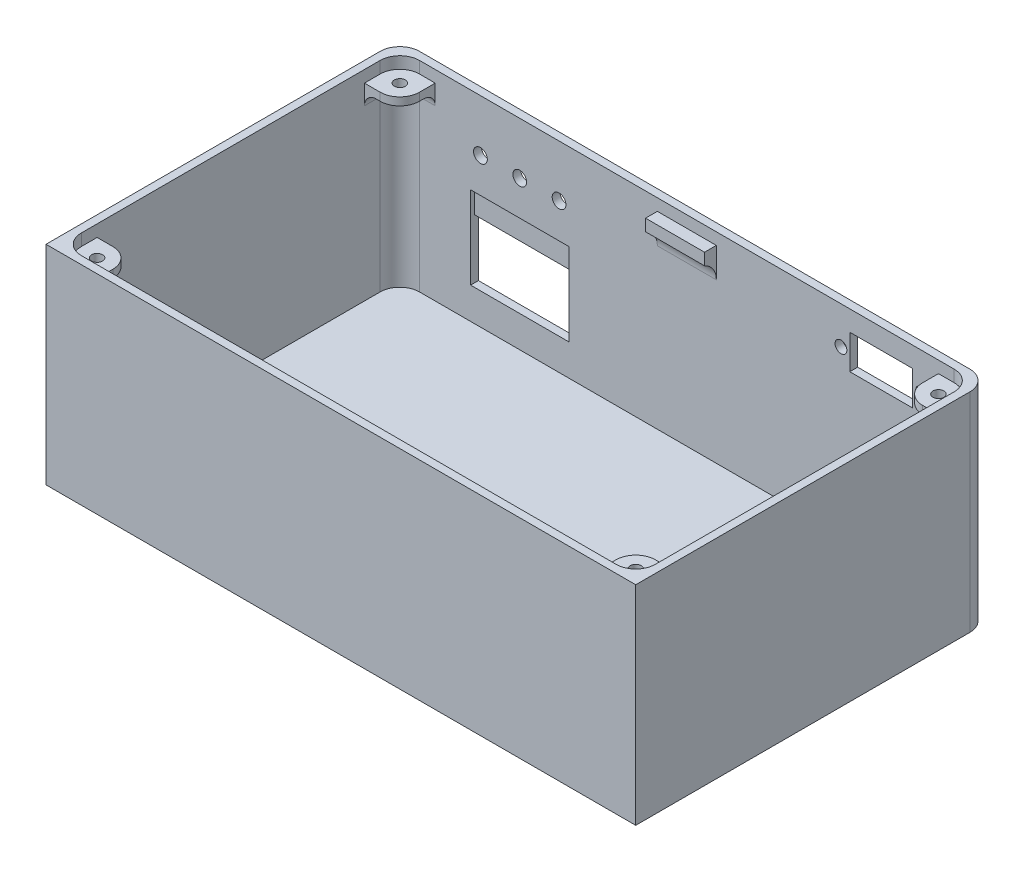
from build123d import *

# Parameters (mm, degrees)
SKETCH1_W           = 150
SKETCH1_H           = 90
BOSS_EXTRUDE1_DEPTH = 50
SHELL1_T            = -2
SKETCH2_W           = 9
SKETCH2_H           = 9
BOSS_EXTRUDE2_DEPTH = 2
SKETCH10_R          = 1.4
CUT_EXTRUDE5_DEPTH  = 14
SKETCH13_R          = 1.9
BOSS_EXTRUDE4_DEPTH = 150
SKETCH14_W          = 152.119468056
SKETCH14_H          = 14
CUT_EXTRUDE7_DEPTH  = 176
SKETCH15_W          = 150
SKETCH15_H          = 90
BOSS_EXTRUDE5_DEPTH = 3
SKETCH16_W          = 15
SKETCH16_H          = 3
BOSS_EXTRUDE6_DEPTH = 3
FILLET1_R           = 5
SKETCH17_R          = 7
CUT_EXTRUDE8_DEPTH  = 10
SKETCH19_R          = 1.5
SKETCH19_R_2        = 1.75
SKETCH19_W          = 25
SKETCH19_H          = 15
SKETCH19_W_2        = 16
SKETCH19_H_2        = 8.7
CUT_EXTRUDE9_DEPTH  = 10
SKETCH21_W          = 1.346153846
SKETCH21_H          = 0.358974358
CUT_EXTRUDE10_DEPTH = 0.5
SKETCH23_W          = 25
SKETCH23_H          = 21
CUT_EXTRUDE12_DEPTH = 1
FILLET2_R           = 5
FILLET3_R           = 3


with BuildPart() as part:
    # Sketch1 → Boss-Extrude1 (new body)
    with BuildSketch(Plane(origin=(0, 0, 0), x_dir=(1, 0, 0), z_dir=(0, 1, 0))):
        with Locations((-0.132743363, -2.986725664)):
            Rectangle(SKETCH1_W, SKETCH1_H)
    extrude(amount=BOSS_EXTRUDE1_DEPTH)

    # Shell1
    shell1_openings = [part.faces().sort_by_distance(p)[0] for p in [
        (-0.132743363, 50, 2.986725664),
    ]]
    offset(amount=SHELL1_T, openings=shell1_openings, kind=Kind.INTERSECTION)

    # Sketch2 → Boss-Extrude2 (add)
    with BuildSketch(Plane(origin=(0, 50, 0), x_dir=(1, 0, 0), z_dir=(0, 1, 0))):
        with Locations((-68.632743363, -41.486725664)):
            Rectangle(SKETCH2_W, SKETCH2_H)
        with Locations((-68.632743363, 35.513274336)):
            Rectangle(SKETCH2_W, SKETCH2_H)
        with Locations((68.367256637, -41.486725664)):
            Rectangle(SKETCH2_W, SKETCH2_H)
        with Locations((68.367256637, 35.513274336)):
            Rectangle(SKETCH2_W, SKETCH2_H)
    extrude(amount=-BOSS_EXTRUDE2_DEPTH)

    # Sketch10 → Cut-Extrude5 (cut)
    with BuildSketch(Plane(origin=(0, 50, 0), x_dir=(1, 0, 0), z_dir=(0, 1, 0))):
        with Locations(Location((-68.632743363, 35.513274336, 0), (0, 0, 270))):
            Circle(SKETCH10_R)
        with Locations(Location((-68.632743363, -41.486725664, 0), (0, 0, 270))):
            Circle(SKETCH10_R)
        with Locations(Location((68.367256637, -41.486725664, 0), (0, 0, 270))):
            Circle(SKETCH10_R)
        with Locations(Location((68.367256637, 35.513274336, 0), (0, 0, 270))):
            Circle(SKETCH10_R)
    extrude(amount=-CUT_EXTRUDE5_DEPTH, mode=Mode.SUBTRACT)

    # Sketch13 → Boss-Extrude4 (add)
    with BuildSketch(Plane.ZY.offset(75.132743363)):
        with BuildLine():
            Line((47.986725664, 0), (45.986725664, -5))
            ThreePointArc((45.986725664, -5), (40.986725664, -10), (35.986725664, -5))
            Line((35.986725664, -5), (35.986725664, 0))
            Line((35.986725664, 0), (47.986725664, 0))
        make_face()
        with Locations((40.986725664, -5)):
            Circle(SKETCH13_R, mode=Mode.SUBTRACT)
    extrude(amount=-BOSS_EXTRUDE4_DEPTH)

    # Sketch14 → Cut-Extrude7 (cut)
    with BuildSketch(Plane.XZ):
        with Locations((-0.142633699, 40.986725664)):
            Rectangle(SKETCH14_W, SKETCH14_H)
    extrude(amount=CUT_EXTRUDE7_DEPTH, mode=Mode.SUBTRACT)

    # Sketch15 → Boss-Extrude5 (add)
    with BuildSketch(Plane(origin=(0, 50, 0), x_dir=(1, 0, 0), z_dir=(0, 1, 0))):
        with Locations((-0.132743363, -2.986725664)):
            Rectangle(SKETCH15_W, SKETCH15_H)
        Polygon((-73.132743363, 40.013274336), (72.044159397, 40.013274336), (72.867256637, 40.013274336), (72.867256637, 31.013274336), (72.867256637, -36.986725664), (72.867256637, -45.986725664), (72.044159397, -45.986725664), (-73.132743363, -45.986725664), align=None, mode=Mode.SUBTRACT)
    extrude(amount=BOSS_EXTRUDE5_DEPTH)

    # Sketch16 → Boss-Extrude6 (add)
    with BuildSketch(Plane.XY.offset(-40.013274336)):
        with Locations((-0.132743363, 48.5)):
            Rectangle(SKETCH16_W, SKETCH16_H)
    boss_extrude6 = extrude(amount=BOSS_EXTRUDE6_DEPTH)

    # Mirror1: Boss-Extrude6 across plane
    add(boss_extrude6.mirror(Plane.XY.offset(2.986725664)))

    # Fillet1
    fillet1_edges = [part.edges().sort_by_distance(p)[0] for p in [
        (63.867256637, 49, -31.013274336),
        (63.867256637, 49, 36.986725664),
        (-64.132743363, 49, 36.986725664),
        (-64.132743363, 49, -31.013274336),
    ]]
    fillet(fillet1_edges, radius=FILLET1_R)

    # Sketch17 → Cut-Extrude8 (cut)
    with BuildSketch(Plane(origin=(0, 2, 0), x_dir=(1, 0, 0), z_dir=(0, 1, 0))):
        with Locations(Location((-25.132743363, -2.986725664, 0), (0, 0, 270))):
            Circle(SKETCH17_R)
        with Locations(Location((24.867256637, -2.986725664, 0), (0, 0, 270))):
            Circle(SKETCH17_R)
    extrude(amount=-CUT_EXTRUDE8_DEPTH, mode=Mode.SUBTRACT)

    # Sketch19 → Cut-Extrude9 (cut)
    with BuildSketch(Plane(origin=(0, 0, -42.013274336), x_dir=(-1, 0, 0), z_dir=(0, 0, -1))):
        with Locations((-39.067256637, 43.5)):
            Circle(SKETCH19_R)
        with Locations((-59.567256637, 43.5)):
            Circle(SKETCH19_R)
        with Locations((52.632743363, 39.810326453)):
            Circle(SKETCH19_R_2)
        with Locations((42.632743363, 39.810326453)):
            Circle(SKETCH19_R_2)
        with Locations((32.632743363, 39.810326453)):
            Circle(SKETCH19_R_2)
        with Locations((42.632743363, 17.5)):
            Rectangle(SKETCH19_W, SKETCH19_H)
        with Locations((-49.317256637, 43.5)):
            Rectangle(SKETCH19_W_2, SKETCH19_H_2)
    extrude(amount=-CUT_EXTRUDE9_DEPTH, mode=Mode.SUBTRACT)

    # Sketch21 → Cut-Extrude10 (cut)
    with BuildSketch(Plane(origin=(0, 0, -42.013274336), x_dir=(-1, 0, 0), z_dir=(0, 0, -1))):
        Polygon((52.94662403, 44.571959528), (52.94662403, 43.539908245), (52.632521466, 43.539908245), (52.632521466, 44.571959528), (51.600470184, 44.571959528), (51.600470184, 44.886062092), (52.632521466, 44.886062092), (52.632521466, 45.918113374), (52.94662403, 45.918113374), (52.94662403, 44.886062092), (53.978675312, 44.886062092), (53.978675312, 44.571959528), align=None)
        with Locations((42.44662403, 45.110421066)):
            Rectangle(SKETCH21_W, SKETCH21_H)
        Polygon((34.638931723, 46.456574912), (34.17689246, 42.956574912), (34.132020665, 42.956574912), (32.687008646, 45.828369784), (31.246203357, 42.956574912), (31.201331562, 42.956574912), (30.735085569, 46.456574912), (31.049188133, 46.456574912), (31.385726594, 43.94024879), (32.648446947, 46.456574912), (32.71996137, 46.456574912), (33.988290697, 43.932536451), (34.322725793, 46.456574912), align=None)
    extrude(amount=-CUT_EXTRUDE10_DEPTH, mode=Mode.SUBTRACT)

    # Sketch23 → Cut-Extrude12 (cut)
    with BuildSketch(Plane.XY.offset(-40.013274336)):
        with Locations((-42.632743363, 20.5)):
            Rectangle(SKETCH23_W, SKETCH23_H)
    extrude(amount=-CUT_EXTRUDE12_DEPTH, mode=Mode.SUBTRACT)

    # Fillet2
    # the kernel refuses this fillet: 5 mm, written as the material it adds along each edge
    with BuildSketch(Plane(origin=(-73.132743363, 37.5, 45.986725664), x_dir=(1, 0, 0), z_dir=(0, 1, 0)), Plane(origin=(72.867256637, 37.5, -40.013274336), x_dir=(-1, 0, 0), z_dir=(0, 1, 0))) as fillet2_piece_1:
        with BuildLine():
            CenterArc((FILLET2_R, FILLET2_R), FILLET2_R, 180, 90)
            Line((0, FILLET2_R), (0, 0))
            Line((0, 0), (FILLET2_R, 0))
        make_face()
    extrude(amount=15.5)
    with BuildSketch(Plane(origin=(72.867256637, 37.5, 45.986725664), x_dir=(-1, 0, 0), z_dir=(0, 1, 0)), Plane(origin=(-73.132743363, 37.5, -40.013274336), x_dir=(1, 0, 0), z_dir=(0, 1, 0))) as fillet2_piece_2:
        with BuildLine():
            CenterArc((FILLET2_R, -FILLET2_R), FILLET2_R, 90, 90)
            Line((0, -FILLET2_R), (0, 0))
            Line((0, 0), (FILLET2_R, 0))
        make_face()
    extrude(amount=15.5)
    with BuildSketch(Plane(origin=(7.367256637, 47, -40.013274336), x_dir=(0, -1, 0), z_dir=(-1, 0, 0))) as fillet2_piece_3:
        with BuildLine():
            CenterArc((4.582575695, 5), FILLET2_R, 203.578178478, 66.421821522)
            Line((0, 3), (0, 0))
            Line((0, 0), (4.582575695, 0))
        make_face()
    extrude(amount=15)
    with BuildSketch(Plane(origin=(7.367256637, 47, 45.986725664), x_dir=(0, -1, 0), z_dir=(-1, 0, 0))) as fillet2_piece_4:
        with BuildLine():
            CenterArc((4.582575695, -5), FILLET2_R, 90, 66.421821522)
            Line((0, -3), (0, 0))
            Line((0, 0), (4.582575695, 0))
        make_face()
    extrude(amount=15)
    with BuildSketch(Plane(origin=(72.867256637, 60.5, -40.013274336), x_dir=(-1, 0, 0), z_dir=(0, -1, 0))) as fillet2_piece_5_section:
        with BuildLine():
            CenterArc((FILLET2_R, -FILLET2_R), FILLET2_R, 90, 90)
            Line((0, -FILLET2_R), (0, 0))
            Line((0, 0), (FILLET2_R, 0))
        make_face()
    fillet2_piece_5 = extrude(amount=58.5, mode=Mode.PRIVATE)
    fillet2_piece_5 = split(fillet2_piece_5, bisect_by=Plane(origin=(72.867256637, 53, -40.013274336), z_dir=(0, -1, 0)), keep=Keep.TOP, mode=Mode.PRIVATE)
    add(fillet2_piece_5)
    with BuildSketch(Plane(origin=(-73.132743363, 2, -40.013274336), x_dir=(1, 0, 0), z_dir=(0, 1, 0))) as fillet2_piece_6_section:
        with BuildLine():
            CenterArc((FILLET2_R, -FILLET2_R), FILLET2_R, 90, 90)
            Line((0, -FILLET2_R), (0, 0))
            Line((0, 0), (FILLET2_R, 0))
        make_face()
    fillet2_piece_6 = extrude(amount=58.5, mode=Mode.PRIVATE)
    fillet2_piece_6 = split(fillet2_piece_6, bisect_by=Plane(origin=(-73.132743363, 53, -40.013274336), z_dir=(0, -1, 0)), keep=Keep.TOP, mode=Mode.PRIVATE)
    add(fillet2_piece_6)
    with BuildSketch(Plane(origin=(72.867256637, 60.5, 45.986725664), x_dir=(-1, 0, 0), z_dir=(0, -1, 0))) as fillet2_piece_7_section:
        with BuildLine():
            CenterArc((FILLET2_R, FILLET2_R), FILLET2_R, 180, 90)
            Line((0, FILLET2_R), (0, 0))
            Line((0, 0), (FILLET2_R, 0))
        make_face()
    fillet2_piece_7 = extrude(amount=58.5, mode=Mode.PRIVATE)
    fillet2_piece_7 = split(fillet2_piece_7, bisect_by=Plane(origin=(72.867256637, 53, 45.986725664), z_dir=(0, -1, 0)), keep=Keep.TOP, mode=Mode.PRIVATE)
    add(fillet2_piece_7)
    with BuildSketch(Plane(origin=(-73.132743363, 60.5, 45.986725664), x_dir=(1, 0, 0), z_dir=(0, -1, 0))) as fillet2_piece_8_section:
        with BuildLine():
            CenterArc((FILLET2_R, -FILLET2_R), FILLET2_R, 90, 90)
            Line((0, -FILLET2_R), (0, 0))
            Line((0, 0), (FILLET2_R, 0))
        make_face()
    fillet2_piece_8 = extrude(amount=58.5, mode=Mode.PRIVATE)
    fillet2_piece_8 = split(fillet2_piece_8, bisect_by=Plane(origin=(-73.132743363, 53, 45.986725664), z_dir=(0, -1, 0)), keep=Keep.TOP, mode=Mode.PRIVATE)
    add(fillet2_piece_8)
    # the kernel refuses this fillet: 5 mm, written as the material it takes off along each edge
    with BuildSketch(Plane(origin=(-75.132743363, -12.5, -42.013274336), x_dir=(0, 0, 1), z_dir=(0, 1, 0))) as fillet2_2_piece_1:
        with BuildLine():
            CenterArc((FILLET2_R, FILLET2_R), FILLET2_R, 180, 90)
            Line((0, FILLET2_R), (0, 0))
            Line((0, 0), (FILLET2_R, 0))
        make_face()
    extrude(amount=78, mode=Mode.SUBTRACT)
    with BuildSketch(Plane(origin=(74.867256637, 65.5, -42.013274336), x_dir=(-1, 0, 0), z_dir=(0, -1, 0))) as fillet2_2_piece_2:
        with BuildLine():
            CenterArc((FILLET2_R, -FILLET2_R), FILLET2_R, 90, 90)
            Line((0, -FILLET2_R), (0, 0))
            Line((0, 0), (FILLET2_R, 0))
        make_face()
    extrude(amount=78, mode=Mode.SUBTRACT)

    # Fillet3
    fillet3_edges = [part.edges().sort_by_distance(p)[0] for p in [
        (72.867256637, 48, -33.013274336),
        (-66.132743363, 48, 45.986725664),
        (65.867256637, 48, -40.013274336),
        (-73.132743363, 48, -33.013274336),
        (65.867256637, 48, 45.986725664),
        (72.867256637, 48, 38.986725664),
        (71.402790543, 48, 44.52225957),
        (71.402790543, 48, -38.548808242),
        (-71.668277269, 48, -38.548808242),
        (-71.668277269, 48, 44.52225957),
        (-73.132743363, 48, 38.986725664),
        (-66.132743363, 48, -40.013274336),
    ]]
    fillet(fillet3_edges, radius=FILLET3_R)


solid = part.part
